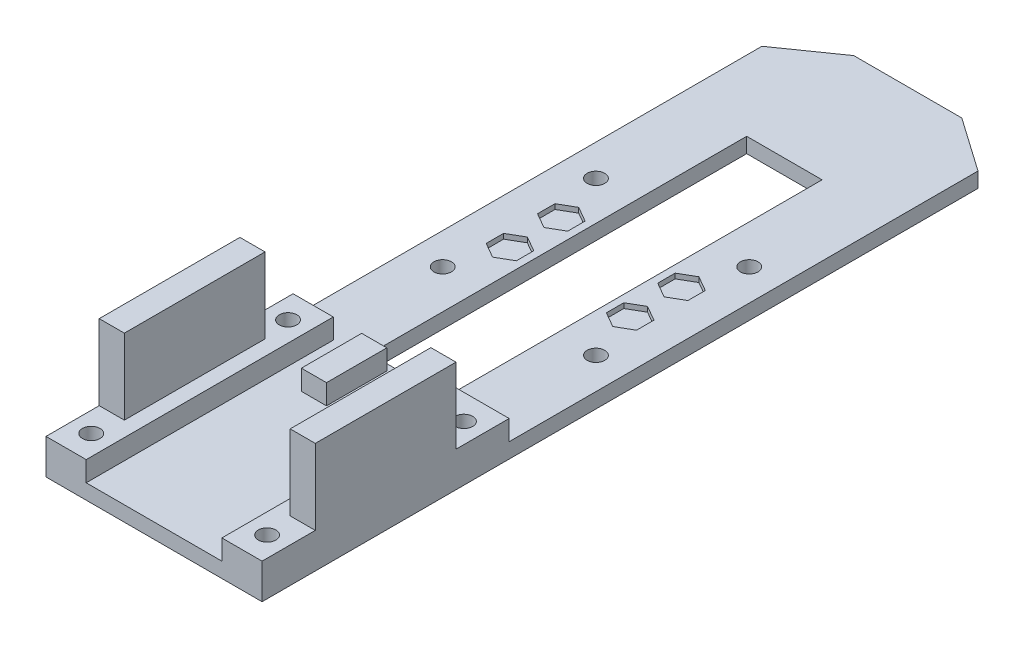
from build123d import *

# Parameters (mm, degrees)
SKETCH1_W           = 43
SKETCH1_H           = 150
BOSS_EXTRUDE1_DEPTH = 3
SKETCH2_R           = 1.75
CUT_EXTRUDE1_DEPTH  = 10
SKETCH3_W           = 15
SKETCH3_H           = 75
CUT_EXTRUDE2_DEPTH  = 10
SKETCH4_W           = 5
SKETCH4_H           = 12
SKETCH4_W_2         = 4.116849784
SKETCH4_H_2         = 1.5
SKETCH4_H_3         = 3.5
BOSS_EXTRUDE2_DEPTH = 4
SKETCH5_W           = 8
SKETCH5_H           = 49.17
BOSS_EXTRUDE3_DEPTH = 4
SKETCH7_W           = 0.35
SKETCH7_H           = 12
BOSS_EXTRUDE4_DEPTH = 4
SKETCH8_R           = 1.75
CUT_EXTRUDE3_DEPTH  = 79.334219853
SKETCH9_W           = 5
SKETCH9_H           = 28
BOSS_EXTRUDE5_DEPTH = 15
SKETCH10_R          = 3
CUT_EXTRUDE5_DEPTH  = 2
CUT_EXTRUDE6_DEPTH  = 81.300996258
CUT_EXTRUDE7_DEPTH  = 1


with BuildPart() as part:
    # Sketch1 → Boss-Extrude1 (new body)
    with BuildSketch(Plane(origin=(0, 0, 0), x_dir=(1, 0, 0), z_dir=(0, 1, 0))):
        Rectangle(SKETCH1_W, SKETCH1_H)
    extrude(amount=BOSS_EXTRUDE1_DEPTH)

    # Sketch2 → Cut-Extrude1 (cut)
    with BuildSketch(Plane(origin=(0, 3, 0), x_dir=(1, 0, 0), z_dir=(0, 1, 0))):
        with Locations((15.25, 28.19)):
            Circle(SKETCH2_R)
        with Locations((-15.25, 28.19)):
            Circle(SKETCH2_R)
        with Locations((-15.25, -2.31)):
            Circle(SKETCH2_R)
        with Locations((15.25, -2.31)):
            Circle(SKETCH2_R)
    extrude(amount=-CUT_EXTRUDE1_DEPTH, mode=Mode.SUBTRACT)

    # Sketch3 → Cut-Extrude2 (cut)
    with BuildSketch(Plane(origin=(0, 3, 0), x_dir=(1, 0, 0), z_dir=(0, 1, 0))):
        with Locations((0, 12.94)):
            Rectangle(SKETCH3_W, SKETCH3_H)
    extrude(amount=-CUT_EXTRUDE2_DEPTH, mode=Mode.SUBTRACT)

    # Sketch4 → Boss-Extrude2 (add)
    with BuildSketch(Plane(origin=(0, 3, 0), x_dir=(1, 0, 0), z_dir=(0, 1, 0))):
        with Locations((-5.35, -31.83)):
            Rectangle(SKETCH4_W, SKETCH4_H)
        with Locations((10.65, -31.83)):
            Rectangle(SKETCH4_W, SKETCH4_H)
        with Locations((4.708424892, -37.08)):
            Rectangle(SKETCH4_W_2, SKETCH4_H_2)
        with Locations((4.708424892, -39.58)):
            Rectangle(SKETCH4_W_2, SKETCH4_H_3)
    extrude(amount=BOSS_EXTRUDE2_DEPTH)

    # Sketch5 → Boss-Extrude3 (add)
    with BuildSketch(Plane(origin=(0, 3, 0), x_dir=(1, 0, 0), z_dir=(0, 1, 0))):
        with Locations((-17.5, -50.415)):
            Rectangle(SKETCH5_W, SKETCH5_H)
        with Locations((17.5, -50.415)):
            Rectangle(SKETCH5_W, SKETCH5_H)
    extrude(amount=BOSS_EXTRUDE3_DEPTH)

    # Sketch7 → Boss-Extrude4 (add)
    with BuildSketch(Plane(origin=(0, 3, 0), x_dir=(1, 0, 0), z_dir=(0, 1, 0))):
        with Locations((13.325, -31.83)):
            Rectangle(SKETCH7_W, SKETCH7_H)
    extrude(amount=BOSS_EXTRUDE4_DEPTH)

    # Sketch8 → Cut-Extrude3 (cut, through all)
    with BuildSketch(Plane(origin=(0, 7, 0), x_dir=(1, 0, 0), z_dir=(0, 1, 0))):
        with Locations((17.5, -70)):
            Circle(SKETCH8_R)
        with Locations((17.5, -30.83)):
            Circle(SKETCH8_R)
        with Locations((-17.5, -70)):
            Circle(SKETCH8_R)
        with Locations((-17.5, -30.83)):
            Circle(SKETCH8_R)
    extrude(amount=-CUT_EXTRUDE3_DEPTH, mode=Mode.SUBTRACT)

    # Sketch9 → Boss-Extrude5 (add)
    with BuildSketch(Plane(origin=(0, 7, 0), x_dir=(1, 0, 0), z_dir=(0, 1, 0))):
        with Locations((19, -50.41)):
            Rectangle(SKETCH9_W, SKETCH9_H)
        with Locations((-19, -50.41)):
            Rectangle(SKETCH9_W, SKETCH9_H)
    extrude(amount=BOSS_EXTRUDE5_DEPTH)

    # Sketch10 → Cut-Extrude5 (cut)
    with BuildSketch(Plane.XZ):
        with Locations((-17.5, 70)):
            Circle(SKETCH10_R)
        with Locations((-17.5, 30.83)):
            Circle(SKETCH10_R)
        with Locations((17.5, 30.83)):
            Circle(SKETCH10_R)
        with Locations((17.5, 70)):
            Circle(SKETCH10_R)
    extrude(amount=-CUT_EXTRUDE5_DEPTH, mode=Mode.SUBTRACT)

    # Sketch11 → Cut-Extrude6 (cut, through all)
    with BuildSketch(Plane(origin=(0, 3, 0), x_dir=(1, 0, 0), z_dir=(0, 1, 0))):
        Polygon((-21.5, 75), (-10.75, 75), (-21.5, 67.472768964), align=None)
        Polygon((10.75, 75), (21.5, 67.472768964), (21.5, 75), align=None)
    extrude(amount=-CUT_EXTRUDE6_DEPTH, mode=Mode.SUBTRACT)

    # Sketch12 → Cut-Extrude7 (cut)
    with BuildSketch(Plane(origin=(0, 3, 0), x_dir=(1, 0, 0), z_dir=(0, 1, 0))):
        Polygon((-11.96, 21.476870579), (-14.96, 19.744819772), (-14.96, 16.280718157), (-11.96, 14.548667349), (-8.96, 16.280718157), (-8.96, 19.744819772), align=None)
        Polygon((-11.96, 11.256870579), (-14.96, 9.524819772), (-14.96, 6.060718157), (-11.96, 4.328667349), (-8.96, 6.060718157), (-8.96, 9.524819772), align=None)
        Polygon((8.96, 19.744819772), (11.96, 21.476870579), (14.96, 19.744819772), (14.96, 16.280718157), (11.96, 14.548667349), (8.96, 16.280718157), align=None)
        Polygon((8.96, 9.524819772), (11.96, 11.256870579), (14.96, 9.524819772), (14.96, 6.060718157), (11.96, 4.328667349), (8.96, 6.060718157), align=None)
    extrude(amount=-CUT_EXTRUDE7_DEPTH, mode=Mode.SUBTRACT)


solid = part.part
